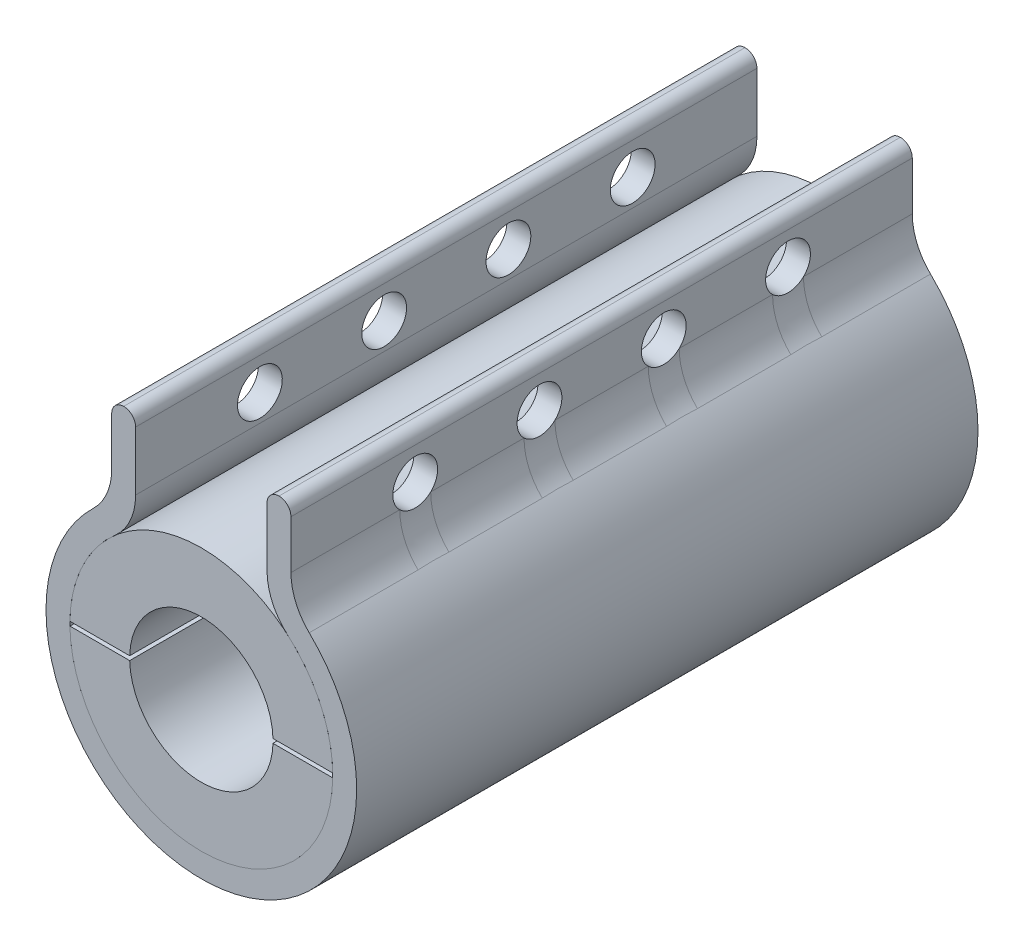
from build123d import *

# Parameters (mm, degrees)
SKETCH1_R           = 11
SKETCH1_R_2         = 9.25
BOSS_EXTRUDE1_DEPTH = 7
SKETCH2_R           = 11
SKETCH2_R_2         = 9.75
BOSS_EXTRUDE2_DEPTH = 17
SKETCH3_R           = 11
SKETCH3_R_2         = 5.75
BOSS_EXTRUDE3_DEPTH = 12
SKETCH4_R           = 11
BOSS_EXTRUDE4_DEPTH = 6
SKETCH5_R           = 11
SKETCH5_R_2         = 6
BOSS_EXTRUDE5_DEPTH = 10
CUT_EXTRUDE1_REACH  = 56.277
SKETCH16_W          = 26.279386949
SKETCH16_H          = 0.35
SKETCH17_R          = 13
SKETCH17_R_2        = 11
BOSS_EXTRUDE6_DEPTH = 52
SKETCH21_W          = 2
SKETCH21_H          = 8.473720558
BOSS_EXTRUDE7_DEPTH = 52
SKETCH22_W          = 11
SKETCH22_H          = 8.473720558
CUT_EXTRUDE3_DEPTH  = 52
CUT_EXTRUDE4_REACH  = 60.722
SKETCH23_R          = 1.875
FILLET1_R           = 1
FILLET2_R           = 5
FILLET3_R           = 5


with BuildPart() as part:
    # Sketch1 → Boss-Extrude1 (new body)
    with BuildSketch(Plane.XY):
        Circle(SKETCH1_R)
        Circle(SKETCH1_R_2, mode=Mode.SUBTRACT)
    extrude(amount=BOSS_EXTRUDE1_DEPTH)

    # Sketch2 → Boss-Extrude2 (add)
    with BuildSketch(Plane.XY.offset(7)):
        Circle(SKETCH2_R)
        Circle(SKETCH2_R_2, mode=Mode.SUBTRACT)
    extrude(amount=BOSS_EXTRUDE2_DEPTH)

    # Sketch3 → Boss-Extrude3 (add)
    with BuildSketch(Plane.XY.offset(24)):
        Circle(SKETCH3_R)
        Circle(SKETCH3_R_2, mode=Mode.SUBTRACT)
    extrude(amount=BOSS_EXTRUDE3_DEPTH)

    # Sketch4 → Boss-Extrude4 (add)
    with BuildSketch(Plane.XY.offset(36)):
        Circle(SKETCH4_R)
        Polygon((-8.082903769, 0), (-4.041451884, -7), (4.041451884, -7), (8.082903769, 0), (4.041451884, 7), (-4.041451884, 7), align=None, mode=Mode.SUBTRACT)
    extrude(amount=BOSS_EXTRUDE4_DEPTH)

    # Sketch5 → Boss-Extrude5 (add)
    with BuildSketch(Plane.XY.offset(42)):
        Circle(SKETCH5_R)
        Circle(SKETCH5_R_2, mode=Mode.SUBTRACT)
    extrude(amount=BOSS_EXTRUDE5_DEPTH)

    # Cut-Extrude1: up to this face of the body (flat: up to its plane)
    cut_extrude1_end = Plane(part.part.faces().sort_by_distance((-10.688873016, 0, 52))[0])
    # Sketch16 → Cut-Extrude1 (cut, up to the picked face)
    with BuildSketch(Plane(origin=(0, 0, 0), x_dir=(-1, 0, 0), z_dir=(0, 0, -1)), mode=Mode.PRIVATE) as cut_extrude1_sk1:
        with Locations((0.165487323, 0)):
            Rectangle(SKETCH16_W, SKETCH16_H)
    cut_extrude1_tool1 = split(extrude(cut_extrude1_sk1.sketch, amount=-CUT_EXTRUDE1_REACH, mode=Mode.PRIVATE), bisect_by=cut_extrude1_end, keep=Keep.BOTH, mode=Mode.PRIVATE)
    add(cut_extrude1_tool1.solids().sort_by(Axis((-0.165487, 0, 0), (0, 0, 1)))[0], mode=Mode.SUBTRACT)


with BuildPart() as cut_extrude1_piece_1:
    # of the separate pieces the step leaves, piece 1, a body of its own (cut_extrude1_pieces)
    add(part.part.solids().sort_by_distance((10.998607866, 0.175, 0))[0])


with BuildPart() as cut_extrude1_piece_2:
    # of the separate pieces the step leaves, piece 2, a body of its own (cut_extrude1_pieces)
    add(part.part.solids().sort_by_distance((10.998607866, -0.175, 52))[0])


with BuildPart() as body_3:
    # Sketch17 → Boss-Extrude6 (new body)
    with BuildSketch(Plane.XY.offset(52)):
        Circle(SKETCH17_R)
        Circle(SKETCH17_R_2, mode=Mode.SUBTRACT)
    extrude(amount=-BOSS_EXTRUDE6_DEPTH)

    # Sketch21 → Boss-Extrude7 (add)
    with BuildSketch(Plane.XY.offset(52)):
        with Locations((6.5, 13.763139721)):
            Rectangle(SKETCH21_W, SKETCH21_H)
        with Locations((-6.5, 13.763139721)):
            Rectangle(SKETCH21_W, SKETCH21_H)
    extrude(amount=-BOSS_EXTRUDE7_DEPTH)

    # Sketch22 → Cut-Extrude3 (cut)
    with BuildSketch(Plane.XY.offset(52)):
        with Locations((0, 13.763139721)):
            Rectangle(SKETCH22_W, SKETCH22_H)
    extrude(amount=-CUT_EXTRUDE3_DEPTH, mode=Mode.SUBTRACT)

    # Cut-Extrude4: up to this face of the body (flat: up to its plane)
    cut_extrude4_end = Plane(body_3.part.faces().sort_by_distance((-7.5, 14.309190145, 26))[0])
    # Sketch23 → Cut-Extrude4 (cut, up to the picked face)
    with BuildSketch(Plane(origin=(7.5, 0, 0), x_dir=(0, 0, -1), z_dir=(1, 0, 0)), mode=Mode.PRIVATE) as cut_extrude4_sk1:
        with Locations(Location((-41.6, 14.309190145, 0), (0, 0, 270))):
            Circle(SKETCH23_R)
    cut_extrude4_tool1 = split(extrude(cut_extrude4_sk1.sketch, amount=-CUT_EXTRUDE4_REACH, mode=Mode.PRIVATE), bisect_by=cut_extrude4_end, keep=Keep.BOTH, mode=Mode.PRIVATE)
    # Sketch23 → Cut-Extrude4 (cut, up to the picked face)
    with BuildSketch(Plane(origin=(7.5, 0, 0), x_dir=(0, 0, -1), z_dir=(1, 0, 0)), mode=Mode.PRIVATE) as cut_extrude4_sk2:
        with Locations(Location((-31.2, 14.309190145, 0), (0, 0, 270))):
            Circle(SKETCH23_R)
    cut_extrude4_tool2 = split(extrude(cut_extrude4_sk2.sketch, amount=-CUT_EXTRUDE4_REACH, mode=Mode.PRIVATE), bisect_by=cut_extrude4_end, keep=Keep.BOTH, mode=Mode.PRIVATE)
    # Sketch23 → Cut-Extrude4 (cut, up to the picked face)
    with BuildSketch(Plane(origin=(7.5, 0, 0), x_dir=(0, 0, -1), z_dir=(1, 0, 0)), mode=Mode.PRIVATE) as cut_extrude4_sk3:
        with Locations(Location((-10.4, 14.309190145, 0), (0, 0, 270))):
            Circle(SKETCH23_R)
    cut_extrude4_tool3 = split(extrude(cut_extrude4_sk3.sketch, amount=-CUT_EXTRUDE4_REACH, mode=Mode.PRIVATE), bisect_by=cut_extrude4_end, keep=Keep.BOTH, mode=Mode.PRIVATE)
    # Sketch23 → Cut-Extrude4 (cut, up to the picked face)
    with BuildSketch(Plane(origin=(7.5, 0, 0), x_dir=(0, 0, -1), z_dir=(1, 0, 0)), mode=Mode.PRIVATE) as cut_extrude4_sk4:
        with Locations(Location((-20.8, 14.309190145, 0), (0, 0, 270))):
            Circle(SKETCH23_R)
    cut_extrude4_tool4 = split(extrude(cut_extrude4_sk4.sketch, amount=-CUT_EXTRUDE4_REACH, mode=Mode.PRIVATE), bisect_by=cut_extrude4_end, keep=Keep.BOTH, mode=Mode.PRIVATE)
    add(cut_extrude4_tool1.solids().sort_by(Axis((7.5, 14.30919, 41.6), (-1, 0, 0)))[0], mode=Mode.SUBTRACT)
    add(cut_extrude4_tool2.solids().sort_by(Axis((7.5, 14.30919, 31.2), (-1, 0, 0)))[0], mode=Mode.SUBTRACT)
    add(cut_extrude4_tool3.solids().sort_by(Axis((7.5, 14.30919, 10.4), (-1, 0, 0)))[0], mode=Mode.SUBTRACT)
    add(cut_extrude4_tool4.solids().sort_by(Axis((7.5, 14.30919, 20.8), (-1, 0, 0)))[0], mode=Mode.SUBTRACT)

    # Fillet1
    fillet1_edges = [body_3.edges().sort_by_distance(p)[0] for p in [
        (7.5, 18, 26),
        (-7.5, 18, 26),
        (-5.5, 18, 26),
        (5.5, 18, 26),
    ]]
    fillet(fillet1_edges, radius=FILLET1_R - 0.0001)  # a hair under: the kernel refuses the full size

    # Fillet2
    fillet2_edges = [body_3.edges().sort_by_distance(p)[0] for p in [
        (-7.5, 10.618380291, 26),
        (7.5, 10.618380291, 26),
    ]]
    fillet(fillet2_edges, radius=FILLET2_R)

    # Fillet3
    fillet3_edges = [body_3.edges().sort_by_distance(p)[0] for p in [
        (-5.5, 9.526279442, 26),
        (5.5, 9.526279442, 26),
    ]]
    fillet(fillet3_edges, radius=FILLET3_R)


solid = Compound([cut_extrude1_piece_1.part, cut_extrude1_piece_2.part, body_3.part])
